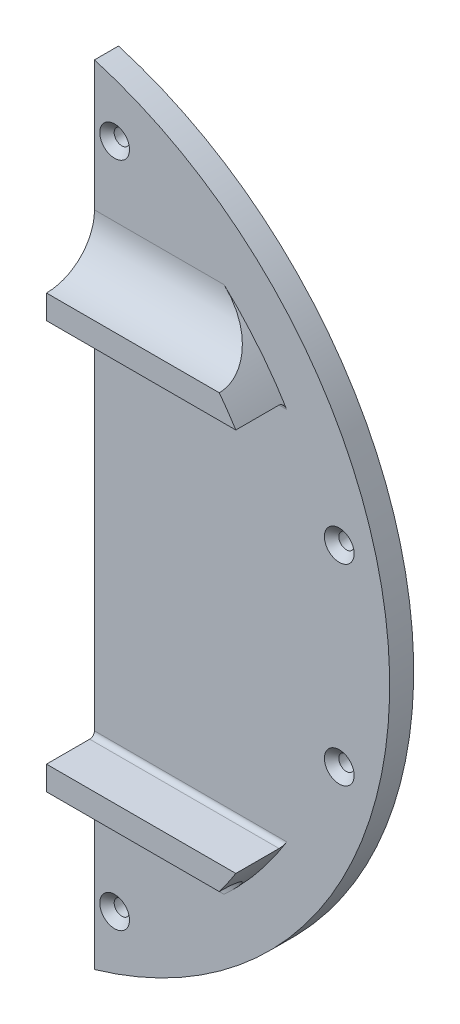
from build123d import *

# Parameters (mm, degrees)
SKETCH1_R           = 1.6
BOSS_EXTRUDE2_DEPTH = 5
BOSS_EXTRUDE3_DEPTH = 10
CHAMFER1_SIZE       = 1.5
FILLET1_R           = 10
FILLET2_R           = 1


with BuildPart() as part:
    # Sketch1 → Boss-Extrude2 (new body)
    with BuildSketch(Plane(origin=(0, 0, 0), x_dir=(0, 1, 0), z_dir=(0, 0, 1))):
        with BuildLine():
            Line((-82.0624762, -24), (82.0624762, -24))
            ThreePointArc((82.0624762, -24), (0, -85.5), (-82.0624762, -24))
        make_face()
        with Locations(Location((-20, -75, 0), (0, 0, 270))):
            Circle(SKETCH1_R, mode=Mode.SUBTRACT)
        with Locations(Location((20, -75, 0), (0, 0, 90))):
            Circle(SKETCH1_R, mode=Mode.SUBTRACT)
        with Locations(Location((-69.5, -28.2, 0), (0, 0, 270))):
            Circle(SKETCH1_R, mode=Mode.SUBTRACT)
        with Locations(Location((69.5, -28.2, 0), (0, 0, 90))):
            Circle(SKETCH1_R, mode=Mode.SUBTRACT)
    extrude(amount=BOSS_EXTRUDE2_DEPTH)

    # Sketch2 → Boss-Extrude3 (add)
    with BuildSketch(Plane.XY.offset(5)):
        with BuildLine():
            Line((60, 45), (24, 45))
            Line((24, 45), (24, 40))
            Line((24, 40), (63.442887702, 40))
            ThreePointArc((63.442887702, 40), (61.772053803, 42.534848876), (60, 45))
        make_face()
        with BuildLine():
            Line((24, -45), (24, -40))
            Line((24, -40), (63.442887702, -40))
            ThreePointArc((63.442887702, -40), (61.772053803, -42.534848876), (60, -45))
            Line((60, -45), (24, -45))
        make_face()
    extrude(amount=BOSS_EXTRUDE3_DEPTH)

    # Chamfer1
    chamfer1_edges = [part.edges().sort_by_distance(p)[0] for p in [
        (76.6, 20, 5),
        (26.6, -69.5, 5),
        (29.8, 69.5, 5),
        (73.4, -20, 5),
    ]]
    chamfer(chamfer1_edges, length=CHAMFER1_SIZE)

    # Fillet1
    fillet1_edges = [part.edges().sort_by_distance(p)[0] for p in [
        (42, -45, 5),
        (42, 45, 5),
    ]]
    fillet(fillet1_edges, radius=FILLET1_R - 0.0001)  # a hair under: the kernel refuses the full size

    # Fillet2
    fillet2_edges = [part.edges().sort_by_distance(p)[0] for p in [
        (43.721443851, 40, 5),
        (43.721443851, -40, 5),
    ]]
    fillet(fillet2_edges, radius=FILLET2_R)


solid = part.part
